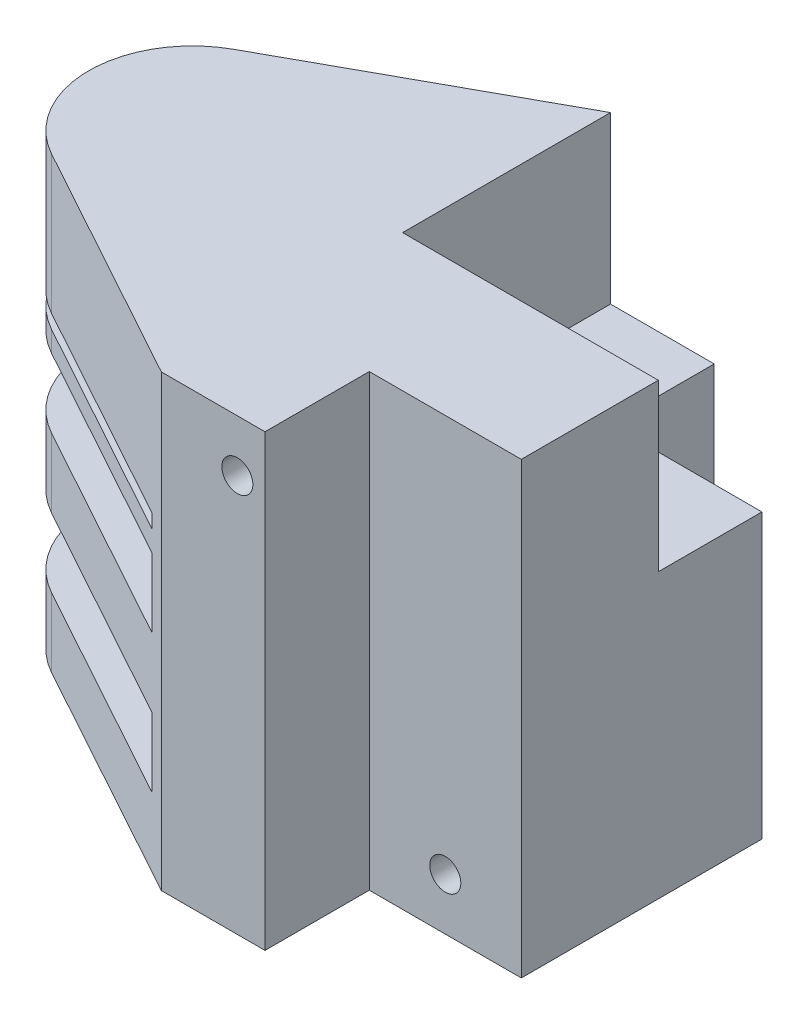
from build123d import *

# Parameters (mm, degrees)
SKETCH1_W               = 80
SKETCH1_H               = 65
BOSS_EXTRUDE1_DEPTH     = 65
SKETCH3_W               = 22
SKETCH3_H               = 15.09
CUT_EXTRUDE1_DEPTH      = 65.72
CUT_EXTRUDE2_DEPTH      = 20
CUT_EXTRUDE2_DEPTH_BACK = 55.72
SKETCH4_R               = 2.24505
SKETCH4_R_2             = 2.245
SKETCH5_W               = 65
SKETCH5_H               = 10
SKETCH5_H_2             = 2
CUT_EXTRUDE3_DEPTH      = 40
SKETCH23_W              = 37
SKETCH23_H              = 30.09
CUT_EXTRUDE15_DEPTH     = 24
CUT_EXTRUDE4_DEPTH      = 65
SKETCH10_R              = 1
CUT_EXTRUDE6_DEPTH      = 42


with BuildPart() as part:
    # Sketch1 → Boss-Extrude1 (new body)
    with BuildSketch(Plane.XY):
        with Locations((40, 32.5)):
            Rectangle(SKETCH1_W, SKETCH1_H)
    extrude(amount=BOSS_EXTRUDE1_DEPTH)

    # Sketch3 → Cut-Extrude1 (cut)
    with BuildSketch(Plane.XZ):
        with Locations((69, 57.455)):
            Rectangle(SKETCH3_W, SKETCH3_H)
        with Locations((69, 7.545)):
            Rectangle(SKETCH3_W, SKETCH3_H)
    extrude(amount=-CUT_EXTRUDE1_DEPTH, mode=Mode.SUBTRACT)

    # Sketch4 → Cut-Extrude2 (cut, two sides: drawn at the far end of the back side and taken through both)
    with BuildSketch(Plane.XY.offset(49.91).offset(-CUT_EXTRUDE2_DEPTH_BACK)):
        with Locations((69, 7.5)):
            Circle(SKETCH4_R)
        with Locations((54, 57.5)):
            Circle(SKETCH4_R_2)
    extrude(amount=CUT_EXTRUDE2_DEPTH + CUT_EXTRUDE2_DEPTH_BACK, mode=Mode.SUBTRACT)

    # Sketch5 → Cut-Extrude3 (cut)
    with BuildSketch(Plane.ZY):
        with Locations((32.5, 15)):
            Rectangle(SKETCH5_W, SKETCH5_H)
        with Locations((32.5, 35)):
            Rectangle(SKETCH5_W, SKETCH5_H)
        with Locations((32.5, 44)):
            Rectangle(SKETCH5_W, SKETCH5_H_2)
    extrude(amount=-CUT_EXTRUDE3_DEPTH, mode=Mode.SUBTRACT)

    # Sketch23 → Cut-Extrude15 (cut)
    with BuildSketch(Plane(origin=(0, 65, 0), x_dir=(1, 0, 0), z_dir=(0, 1, 0))):
        with Locations((61.5, -15.045)):
            Rectangle(SKETCH23_W, SKETCH23_H)
    extrude(amount=-CUT_EXTRUDE15_DEPTH, mode=Mode.SUBTRACT)

    # Sketch6 → Cut-Extrude4 (cut)
    with BuildSketch(Plane.XZ):
        with BuildLine():
            Line((0, 0), (43, 0))
            Line((43, 0), (7.776682895, 19.353757571))
            ThreePointArc((7.776682895, 19.353757571), (2.089737482, 24.862911437), (0, 32.5))
            Line((0, 32.5), (0, 0))
        make_face()
        with BuildLine():
            Line((0, 65), (0, 32.5))
            ThreePointArc((0, 32.5), (2.089737482, 40.137088563), (7.776682895, 45.646242429))
            Line((7.776682895, 45.646242429), (43, 65))
            Line((43, 65), (0, 65))
        make_face()
    extrude(amount=-CUT_EXTRUDE4_DEPTH, mode=Mode.SUBTRACT)

    # Sketch10 → Cut-Extrude6 (cut)
    with BuildSketch(Plane.XZ):
        with Locations((15, 32.5)):
            Circle(SKETCH10_R)
    extrude(amount=-CUT_EXTRUDE6_DEPTH, mode=Mode.SUBTRACT)


with BuildPart() as part_1:
    # Body-Move/Copy1: moved
    add(part.part.moved(Location((-15.00003935, 0, -32.58284488))))


solid = part_1.part
